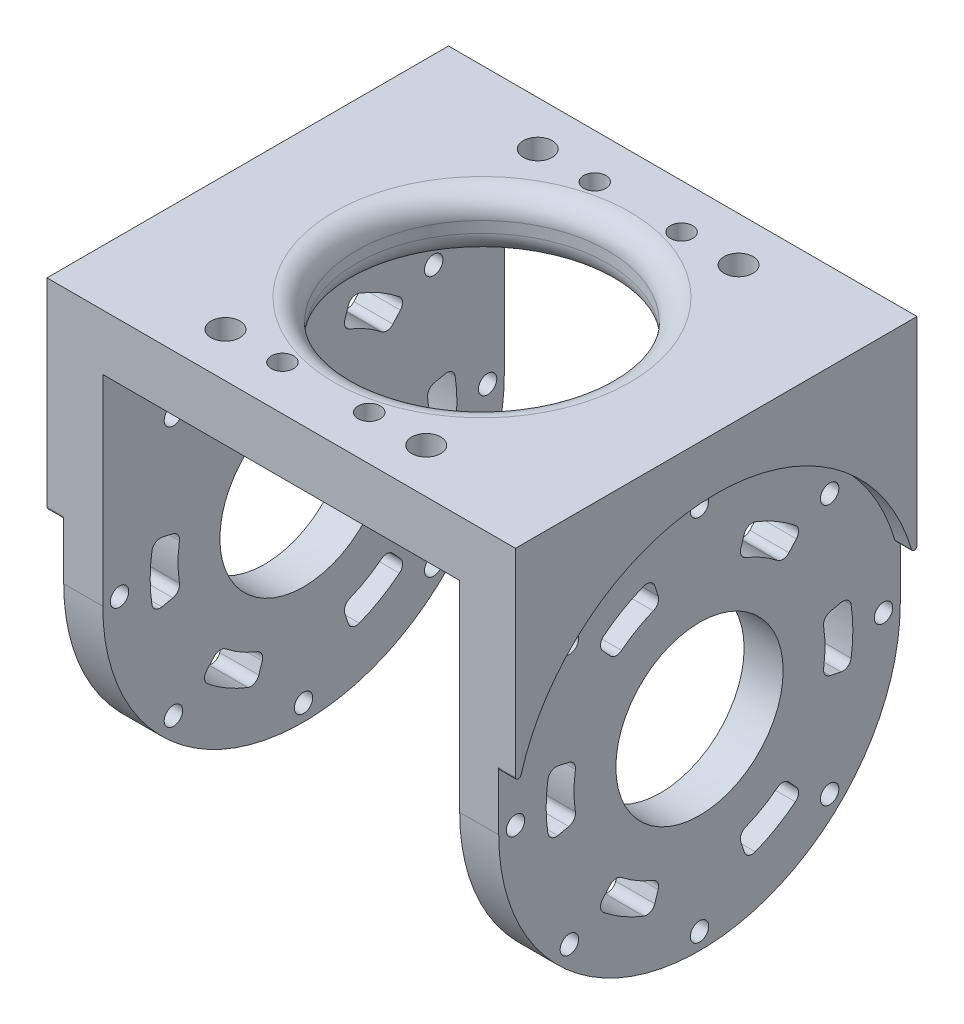
from build123d import *

# Parameters (mm, degrees)
SKETCH1_W                = 84
SKETCH1_H                = 72
BOSS_EXTRUDE1_DEPTH      = 10
SKETCH2_W                = 10
SKETCH2_H                = 72
BOSS_EXTRUDE2_DEPTH      = 72
CUT_EXTRUDE1_REACH       = 134
SKETCH16_R               = 22.5
CUT_EXTRUDE10_DEPTH      = 10
FILLET1_R                = 4
SKETCH17_R               = 36.5
CUT_EXTRUDE12_DEPTH      = 3
SKETCH18_R               = 15
CUT_EXTRUDE13_DEPTH      = 71
CUT_EXTRUDE14_DEPTH      = 71
SKETCH20_R               = 1.65
CUT_EXTRUDE15_DEPTH      = 71
FILLET2_R                = 1.5
CIRPATTERN3_COUNT        = 8
CIRPATTERN4_COUNT        = 6
FILLET2_OF_CIRPATTERN4_R = 1.5
FILLET3_R                = 0.5
MIRROR1_DEPTH            = 3
MIRROR1_START            = 3
MIRROR1_2_OUTLINE_R      = 15
MIRROR1_2_OUTLINE_R_2    = 1.65
MIRROR1_2_DEPTH          = 7
SKETCH22_R               = 2.6
SKETCH22_R_2             = 1.35
CUT_EXTRUDE16_DEPTH      = 10
CIRPATTERN5_COUNT        = 2
CUT_EXTRUDE17_DEPTH      = 4.5
SKETCH24_R               = 2
CUT_EXTRUDE18_DEPTH      = 4


# Read off the part's stored shape, not the designer's step: Mirror1
with BuildPart() as part:
    # Sketch1 → Boss-Extrude1 (new body)
    with BuildSketch(Plane(origin=(0, 0, 0), x_dir=(1, 0, 0), z_dir=(0, 1, 0))):
        with Locations((42, -36)):
            Rectangle(SKETCH1_W, SKETCH1_H)
    extrude(amount=BOSS_EXTRUDE1_DEPTH)

    # Sketch2 → Boss-Extrude2 (add)
    with BuildSketch(Plane.XZ):
        with Locations((5, 36)):
            Rectangle(SKETCH2_W, SKETCH2_H)
        with Locations((79, 36)):
            Rectangle(SKETCH2_W, SKETCH2_H)
    extrude(amount=BOSS_EXTRUDE2_DEPTH)

    # Cut-Extrude1: up to this face of the body (flat: up to its plane)
    cut_extrude1_end = Plane(part.part.faces().sort_by_distance((84, -31, 36))[0])
    # Sketch3 → Cut-Extrude1 (cut, up to the picked face)
    with BuildSketch(Plane.ZY, mode=Mode.PRIVATE) as cut_extrude1_sk1:
        with BuildLine():
            Line((0, -36), (0, -86.150715238))
            Line((0, -86.150715238), (72, -86.150715238))
            Line((72, -86.150715238), (72, -36))
            ThreePointArc((72, -36), (36, -72), (0, -36))
        make_face()
    cut_extrude1_tool1 = split(extrude(cut_extrude1_sk1.sketch, amount=-CUT_EXTRUDE1_REACH, mode=Mode.PRIVATE), bisect_by=cut_extrude1_end, keep=Keep.BOTH, mode=Mode.PRIVATE)
    add(cut_extrude1_tool1.solids().sort_by(Axis((0, -73.736914, 36), (1, 0, 0)))[0], mode=Mode.SUBTRACT)

    # Sketch16 → Cut-Extrude10 (cut)
    with BuildSketch(Plane(origin=(0, 10, 0), x_dir=(1, 0, 0), z_dir=(0, 1, 0))):
        with Locations(Location((42, -36, 0), (0, 0, 270))):
            Circle(SKETCH16_R)
    extrude(amount=-CUT_EXTRUDE10_DEPTH, mode=Mode.SUBTRACT)

    # Fillet1
    fillet1_edges = [part.edges().sort_by_distance(p)[0] for p in [
        (42, 10, 13.5),
        (42, 0, 13.5),
    ]]
    fillet(fillet1_edges, radius=FILLET1_R)

    # Sketch17 → Cut-Extrude12 (cut)
    with BuildSketch(Plane(origin=(84, 0, 0), x_dir=(0, 0, -1), z_dir=(1, 0, 0))):
        with Locations((-36, -36)):
            Circle(SKETCH17_R)
    extrude(amount=-CUT_EXTRUDE12_DEPTH, mode=Mode.SUBTRACT)

    # Sketch18 → Cut-Extrude13 (cut)
    with BuildSketch(Plane(origin=(81, 0, 0), x_dir=(0, 0, -1), z_dir=(1, 0, 0))):
        with Locations((-36, -36)):
            Circle(SKETCH18_R)
    extrude(amount=-CUT_EXTRUDE13_DEPTH, mode=Mode.SUBTRACT)

    # Sketch19 → Cut-Extrude14 (cut)
    with BuildSketch(Plane(origin=(81, 0, 0), x_dir=(0, 0, -1), z_dir=(1, 0, 0))):
        with BuildLine():
            Line((-51.055438643, -19.279241427), (-54.401091675, -15.563517299))
            ThreePointArc((-54.401091675, -15.563517299), (-49.75, -12.184301396), (-44.497967345, -9.845945802))
            Line((-44.497967345, -9.845945802), (-42.952882373, -14.601228383))
            ThreePointArc((-42.952882373, -14.601228383), (-47.25, -16.514428415), (-51.055438643, -19.279241427))
        make_face()
    cut_extrude14 = extrude(amount=-CUT_EXTRUDE14_DEPTH, mode=Mode.SUBTRACT)

    # Sketch20 → Cut-Extrude15 (cut)
    with BuildSketch(Plane(origin=(81, 0, 0), x_dir=(0, 0, -1), z_dir=(1, 0, 0))):
        with Locations((-36, -3)):
            Circle(SKETCH20_R)
    cut_extrude15 = extrude(amount=-CUT_EXTRUDE15_DEPTH, mode=Mode.SUBTRACT)

    # Fillet2
    fillet2_edges = [part.edges().sort_by_distance(p)[0] for p in [
        (77.5, -15.563517299, 54.401091675),
        (77.5, -9.845945802, 44.497967345),
        (77.5, -14.601228383, 42.952882373),
        (77.5, -19.279241427, 51.055438643),
    ]]
    fillet(fillet2_edges, radius=FILLET2_R)

    # CirPattern3: Cut-Extrude15 ×8 about axis
    cirpattern3_axis = Axis((0, -36, 36), (1, 0, 0))
    for i in range(1, CIRPATTERN3_COUNT):
        add(cut_extrude15.rotate(cirpattern3_axis, i * 360 / CIRPATTERN3_COUNT), mode=Mode.SUBTRACT)

    # CirPattern4: Cut-Extrude14 ×6 about axis
    cirpattern4_axis = Axis((0, -36, 36), (1, 0, 0))
    for i in range(1, CIRPATTERN4_COUNT):
        add(cut_extrude14.rotate(cirpattern4_axis, i * 360 / CIRPATTERN4_COUNT), mode=Mode.SUBTRACT)

    # Fillet2 of CirPattern4
    fillet2_of_cirpattern4_edges = [part.edges().sort_by_distance(p)[0] for p in [
        (77.5, -41.717571497, 62.89905902),
        (77.5, -30.282428503, 62.89905902),
        (77.5, -31.321986957, 58.008321017),
        (77.5, -40.678013043, 58.008321017),
        (77.5, -62.154054198, 44.497967345),
        (77.5, -56.436482701, 54.401091675),
        (77.5, -52.720758573, 51.055438643),
        (77.5, -57.398771617, 42.952882373),
        (77.5, -56.436482701, 17.598908325),
        (77.5, -62.154054198, 27.502032655),
        (77.5, -57.398771617, 29.047117627),
        (77.5, -52.720758573, 20.944561357),
        (77.5, -30.282428503, 9.10094098),
        (77.5, -41.717571497, 9.10094098),
        (77.5, -40.678013043, 13.991678983),
        (77.5, -31.321986957, 13.991678983),
        (77.5, -9.845945802, 27.502032655),
        (77.5, -15.563517299, 17.598908325),
        (77.5, -19.279241427, 20.944561357),
        (77.5, -14.601228383, 29.047117627),
    ]]
    fillet(fillet2_of_cirpattern4_edges, radius=FILLET2_OF_CIRPATTERN4_R)

    # Fillet3
    fillet3_edges = [part.edges().sort_by_distance(p)[0] for p in [
        (82.5, -29.979202711, 72),
        (82.5, -29.979202711, 0),
    ]]
    fillet(fillet3_edges, radius=FILLET3_R)

    # Mirror1 outline → Mirror1 (cut)
    with BuildSketch(Plane.YZ):
        with BuildLine():
            ThreePointArc((-25.712596528, 0.97972973), (0.5, 36), (-25.712596528, 71.02027027))
            ThreePointArc((-25.712596528, 71.02027027), (-26.066579681, 71.571186849), (-25.571673193, 72))
            Line((-25.571673193, 72), (-36, 72))
            ThreePointArc((-36, 72), (-72, 36), (-36, 0))
            Line((-36, 0), (-25.571673193, 0))
            ThreePointArc((-25.571673193, 0), (-26.066579681, 0.428813151), (-25.712596528, 0.97972973))
        make_face()
    extrude(amount=MIRROR1_DEPTH, mode=Mode.SUBTRACT)

    # Mirror1 2 outline → Mirror1 2 (cut)
    with BuildSketch(Plane.YZ.offset(MIRROR1_START)):
        with Locations((-36, 36)):
            Circle(MIRROR1_2_OUTLINE_R)
        with BuildLine():
            ThreePointArc((-10.379775035, 45.992700973), (-12.184301396, 49.75), (-14.535954623, 53.191415184))
            ThreePointArc((-14.535954623, 53.191415184), (-15.58502156, 53.748756581), (-16.710416644, 53.368418867))
            Line((-16.710416644, 53.368418867), (-18.199393187, 52.027738365))
            ThreePointArc((-18.199393187, 52.027738365), (-18.690454819, 51.038320338), (-18.370966198, 49.980957306))
            ThreePointArc((-18.370966198, 49.980957306), (-16.514428415, 47.25), (-15.077618902, 44.276712464))
            ThreePointArc((-15.077618902, 44.276712464), (-14.321659967, 43.471345686), (-13.219268004, 43.40190852))
            Line((-13.219268004, 43.40190852), (-11.313716359, 44.021059782))
            ThreePointArc((-11.313716359, 44.021059782), (-10.421636695, 44.805511657), (-10.379775035, 45.992700973))
        make_face()
        with BuildLine():
            ThreePointArc((-14.535954623, 18.808584816), (-12.184301396, 22.25), (-10.379775035, 26.007299027))
            ThreePointArc((-10.379775035, 26.007299027), (-10.421636695, 27.194488343), (-11.313716359, 27.978940218))
            Line((-11.313716359, 27.978940218), (-13.219268004, 28.59809148))
            ThreePointArc((-13.219268004, 28.59809148), (-14.321659967, 28.528654314), (-15.077618902, 27.723287536))
            ThreePointArc((-15.077618902, 27.723287536), (-16.514428415, 24.75), (-18.370966198, 22.019042694))
            ThreePointArc((-18.370966198, 22.019042694), (-18.690454819, 20.961679662), (-18.199393187, 19.972261635))
            Line((-18.199393187, 19.972261635), (-16.710416644, 18.631581133))
            ThreePointArc((-16.710416644, 18.631581133), (-15.58502156, 18.251243419), (-14.535954623, 18.808584816))
        make_face()
        with BuildLine():
            ThreePointArc((-40.156179588, 8.815883843), (-36, 8.5), (-31.843820412, 8.815883843))
            ThreePointArc((-31.843820412, 8.815883843), (-30.836615135, 9.445731762), (-30.603299716, 10.610521351))
            Line((-30.603299716, 10.610521351), (-31.019874817, 12.570353115))
            ThreePointArc((-31.019874817, 12.570353115), (-31.631205147, 13.490333977), (-32.706652704, 13.74233023))
            ThreePointArc((-32.706652704, 13.74233023), (-36, 13.5), (-39.293347296, 13.74233023))
            ThreePointArc((-39.293347296, 13.74233023), (-40.368794853, 13.490333977), (-40.980125183, 12.570353115))
            Line((-40.980125183, 12.570353115), (-41.396700284, 10.610521351))
            ThreePointArc((-41.396700284, 10.610521351), (-41.163384865, 9.445731762), (-40.156179588, 8.815883843))
        make_face()
        with BuildLine():
            ThreePointArc((-61.620224965, 26.007299027), (-59.815698604, 22.25), (-57.464045377, 18.808584816))
            ThreePointArc((-57.464045377, 18.808584816), (-56.41497844, 18.251243419), (-55.289583356, 18.631581133))
            Line((-55.289583356, 18.631581133), (-53.800606813, 19.972261635))
            ThreePointArc((-53.800606813, 19.972261635), (-53.309545181, 20.961679662), (-53.629033802, 22.019042694))
            ThreePointArc((-53.629033802, 22.019042694), (-55.485571585, 24.75), (-56.922381098, 27.723287536))
            ThreePointArc((-56.922381098, 27.723287536), (-57.678340033, 28.528654314), (-58.780731996, 28.59809148))
            Line((-58.780731996, 28.59809148), (-60.686283641, 27.978940218))
            ThreePointArc((-60.686283641, 27.978940218), (-61.578363305, 27.194488343), (-61.620224965, 26.007299027))
        make_face()
        with BuildLine():
            ThreePointArc((-57.464045377, 53.191415184), (-59.815698604, 49.75), (-61.620224965, 45.992700973))
            ThreePointArc((-61.620224965, 45.992700973), (-61.578363305, 44.805511657), (-60.686283641, 44.021059782))
            Line((-60.686283641, 44.021059782), (-58.780731996, 43.40190852))
            ThreePointArc((-58.780731996, 43.40190852), (-57.678340033, 43.471345686), (-56.922381098, 44.276712464))
            ThreePointArc((-56.922381098, 44.276712464), (-55.485571585, 47.25), (-53.629033802, 49.980957306))
            ThreePointArc((-53.629033802, 49.980957306), (-53.309545181, 51.038320338), (-53.800606813, 52.027738365))
            Line((-53.800606813, 52.027738365), (-55.289583356, 53.368418867))
            ThreePointArc((-55.289583356, 53.368418867), (-56.41497844, 53.748756581), (-57.464045377, 53.191415184))
        make_face()
        with BuildLine():
            ThreePointArc((-31.843820412, 63.184116157), (-36, 63.5), (-40.156179588, 63.184116157))
            ThreePointArc((-40.156179588, 63.184116157), (-41.163384865, 62.554268238), (-41.396700284, 61.389478649))
            Line((-41.396700284, 61.389478649), (-40.980125183, 59.429646885))
            ThreePointArc((-40.980125183, 59.429646885), (-40.368794853, 58.509666023), (-39.293347296, 58.25766977))
            ThreePointArc((-39.293347296, 58.25766977), (-36, 58.5), (-32.706652704, 58.25766977))
            ThreePointArc((-32.706652704, 58.25766977), (-31.631205147, 58.509666023), (-31.019874817, 59.429646885))
            Line((-31.019874817, 59.429646885), (-30.603299716, 61.389478649))
            ThreePointArc((-30.603299716, 61.389478649), (-30.836615135, 62.554268238), (-31.843820412, 63.184116157))
        make_face()
        with Locations((-3, 36)):
            Circle(MIRROR1_2_OUTLINE_R_2)
        with Locations((-12.665476221, 59.334523779)):
            Circle(MIRROR1_2_OUTLINE_R_2)
        with Locations((-12.665476221, 12.665476221)):
            Circle(MIRROR1_2_OUTLINE_R_2)
        with Locations((-36, 3)):
            Circle(MIRROR1_2_OUTLINE_R_2)
        with Locations((-59.334523779, 12.665476221)):
            Circle(MIRROR1_2_OUTLINE_R_2)
        with Locations((-69, 36)):
            Circle(MIRROR1_2_OUTLINE_R_2)
        with Locations((-59.334523779, 59.334523779)):
            Circle(MIRROR1_2_OUTLINE_R_2)
        with Locations((-36, 69)):
            Circle(MIRROR1_2_OUTLINE_R_2)
    extrude(amount=MIRROR1_2_DEPTH, mode=Mode.SUBTRACT)

    # Sketch22 → Cut-Extrude16 (cut)
    with BuildSketch(Plane(origin=(0, 10, 0), x_dir=(1, 0, 0), z_dir=(0, 1, 0))):
        with Locations(Location((24, -8, 0), (0, 0, 270))):
            Circle(SKETCH22_R)
        with Locations(Location((24, -64, 0), (0, 0, 270))):
            Circle(SKETCH22_R)
        with Locations(Location((34.22, -8, 0), (0, 0, 270))):
            Circle(SKETCH22_R_2)
        with Locations(Location((34.22, -64, 0), (0, 0, 270))):
            Circle(SKETCH22_R_2)
    cut_extrude16 = extrude(amount=-CUT_EXTRUDE16_DEPTH, mode=Mode.SUBTRACT)

    # CirPattern5: Cut-Extrude16 ×2 about axis
    cirpattern5_axis = Axis((42, 0, 36), (0, 1, 0))
    for i in range(1, CIRPATTERN5_COUNT):
        add(cut_extrude16.rotate(cirpattern5_axis, i * 360 / CIRPATTERN5_COUNT), mode=Mode.SUBTRACT)

    # Sketch23 → Cut-Extrude17 (cut)
    with BuildSketch(Plane.XZ):
        Polygon((26.367136104, 68.1), (21.632863896, 68.1), (19.265727793, 64), (21.632863896, 59.9), (26.367136104, 59.9), (28.734272207, 64), align=None)
        Polygon((21.632863896, 3.9), (26.367136104, 3.9), (28.734272207, 8), (26.367136104, 12.1), (21.632863896, 12.1), (19.265727793, 8), align=None)
        Polygon((64.734272207, 8), (62.367136104, 12.1), (57.632863896, 12.1), (55.265727793, 8), (57.632863896, 3.9), (62.367136104, 3.9), align=None)
        Polygon((64.734272207, 64), (62.367136104, 68.1), (57.632863896, 68.1), (55.265727793, 64), (57.632863896, 59.9), (62.367136104, 59.9), align=None)
    extrude(amount=-CUT_EXTRUDE17_DEPTH, mode=Mode.SUBTRACT)

    # Sketch24 → Cut-Extrude18 (cut)
    with BuildSketch(Plane(origin=(0, 10, 0), x_dir=(1, 0, 0), z_dir=(0, 1, 0))):
        with Locations(Location((34.22, -8, 0), (0, 0, 270))):
            Circle(SKETCH24_R)
        with Locations(Location((49.78, -8, 0), (0, 0, 270))):
            Circle(SKETCH24_R)
        with Locations(Location((34.22, -64, 0), (0, 0, 270))):
            Circle(SKETCH24_R)
        with Locations(Location((49.78, -64, 0), (0, 0, 270))):
            Circle(SKETCH24_R)
    extrude(amount=-CUT_EXTRUDE18_DEPTH, mode=Mode.SUBTRACT)


solid = part.part
